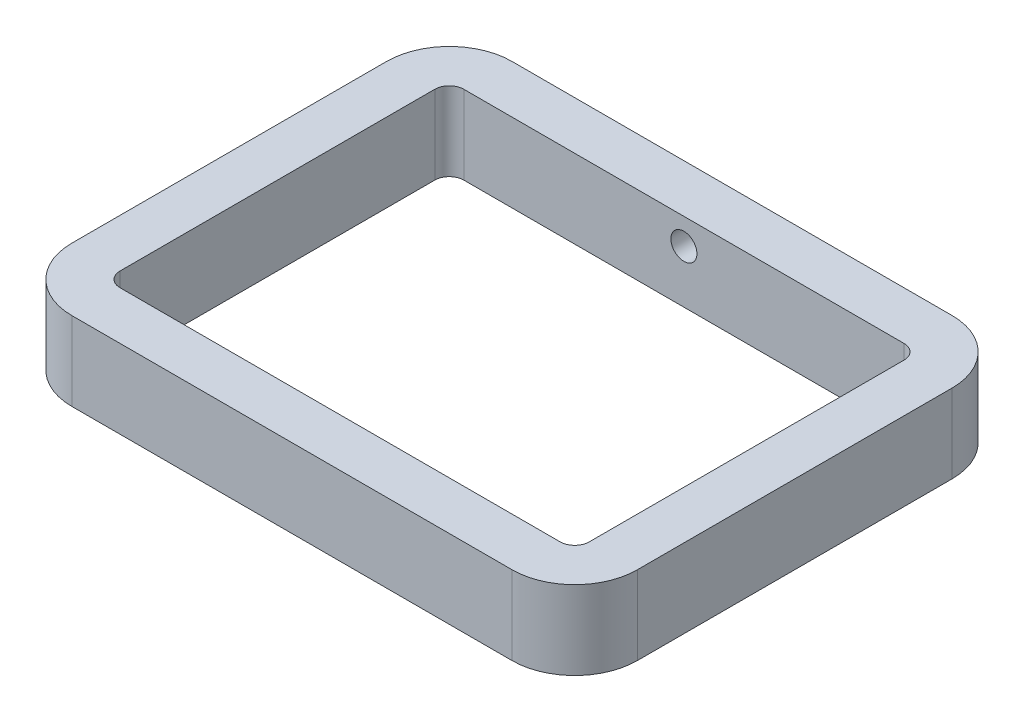
from build123d import *

# Parameters (mm, degrees)
BOSS_EXTRUDE1_DEPTH     = 16
SKETCH2_R               = 2.65
CUT_EXTRUDE1_DEPTH      = 20
CUT_EXTRUDE2_DEPTH      = 104.258989469
CUT_EXTRUDE2_DEPTH_BACK = 104.258989469


with BuildPart() as part:
    # Sketch1 → Boss-Extrude1 (new body)
    with BuildSketch(Plane(origin=(0, 0, 0), x_dir=(1, 0, 0), z_dir=(0, 1, 0))):
        with BuildLine():
            Line((-44.75, 5.2375), (44.75, 5.2375))
            ThreePointArc((44.75, 5.2375), (53.76561146, 1.50311146), (57.5, -7.5125))
            Line((57.5, -7.5125), (57.5, -71.5125))
            ThreePointArc((57.5, -71.5125), (53.76561146, -80.52811146), (44.75, -84.2625))
            Line((44.75, -84.2625), (-44.75, -84.2625))
            ThreePointArc((-44.75, -84.2625), (-53.76561146, -80.52811146), (-57.5, -71.5125))
            Line((-57.5, -71.5125), (-57.5, -7.5125))
            ThreePointArc((-57.5, -7.5125), (-53.76561146, 1.50311146), (-44.75, 5.2375))
        make_face()
        with BuildLine():
            Line((-47.5, -7.5125), (-47.5, -71.5125))
            ThreePointArc((-47.5, -71.5125), (-46.694543648, -73.457043648), (-44.75, -74.2625))
            Line((-44.75, -74.2625), (44.75, -74.2625))
            ThreePointArc((44.75, -74.2625), (46.694543648, -73.457043648), (47.5, -71.5125))
            Line((47.5, -71.5125), (47.5, -7.5125))
            ThreePointArc((47.5, -7.5125), (46.694543648, -5.567956352), (44.75, -4.7625))
            Line((44.75, -4.7625), (-44.75, -4.7625))
            ThreePointArc((-44.75, -4.7625), (-46.694543648, -5.567956352), (-47.5, -7.5125))
        make_face(mode=Mode.SUBTRACT)
    extrude(amount=BOSS_EXTRUDE1_DEPTH)

    # Sketch2 → Cut-Extrude1 (cut)
    with BuildSketch(Plane.XY.offset(4.7625)):
        with Locations((0, 10.721875)):
            Circle(SKETCH2_R)
    extrude(amount=-CUT_EXTRUDE1_DEPTH, mode=Mode.SUBTRACT)

    # Sketch3 → Cut-Extrude2 (cut, two sides: drawn at the far end of the back side and taken through both)
    with BuildSketch(Plane(origin=(0, 0, 0), x_dir=(1, 0, 0), z_dir=(0, 1, 0)).offset(-CUT_EXTRUDE2_DEPTH_BACK)):
        with BuildLine():
            Line((-47.7, -7.5125), (-47.7, -71.5125))
            ThreePointArc((-47.7, -71.5125), (-46.835965004, -73.598465004), (-44.75, -74.4625))
            Line((-44.75, -74.4625), (44.75, -74.4625))
            ThreePointArc((44.75, -74.4625), (46.835965004, -73.598465004), (47.7, -71.5125))
            Line((47.7, -71.5125), (47.7, -7.5125))
            ThreePointArc((47.7, -7.5125), (46.835965004, -5.426534996), (44.75, -4.5625))
            Line((44.75, -4.5625), (-44.75, -4.5625))
            ThreePointArc((-44.75, -4.5625), (-46.835965004, -5.426534996), (-47.7, -7.5125))
        make_face()
        with BuildLine():
            Line((-44.75, -74.2625), (44.75, -74.2625))
            ThreePointArc((44.75, -74.2625), (46.694543648, -73.457043648), (47.5, -71.5125))
            Line((47.5, -71.5125), (47.5, -7.5125))
            ThreePointArc((47.5, -7.5125), (46.694543648, -5.567956352), (44.75, -4.7625))
            Line((44.75, -4.7625), (-44.75, -4.7625))
            ThreePointArc((-44.75, -4.7625), (-46.694543648, -5.567956352), (-47.5, -7.5125))
            Line((-47.5, -7.5125), (-47.5, -71.5125))
            ThreePointArc((-47.5, -71.5125), (-46.694543648, -73.457043648), (-44.75, -74.2625))
        make_face(mode=Mode.SUBTRACT)
    extrude(amount=CUT_EXTRUDE2_DEPTH + CUT_EXTRUDE2_DEPTH_BACK, mode=Mode.SUBTRACT)


solid = part.part
